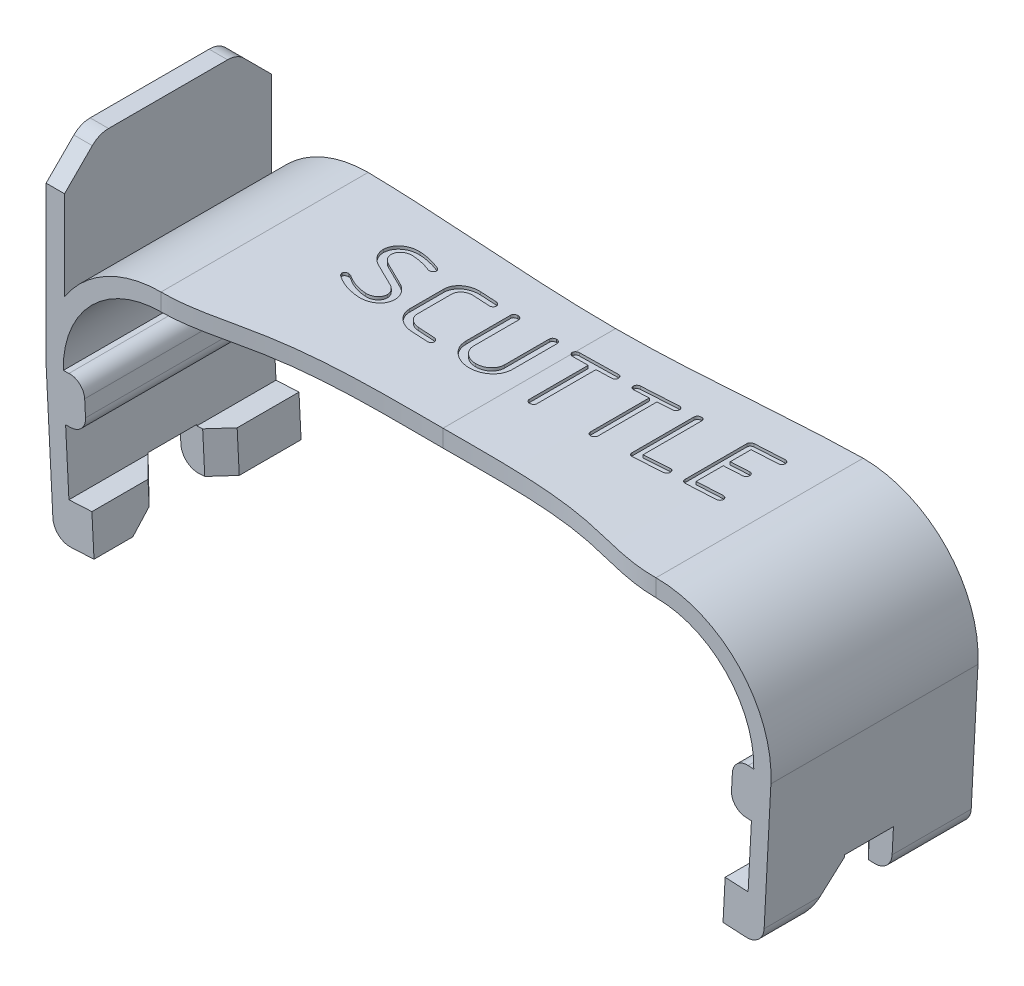
from build123d import *

# Parameters (mm, degrees)
BOSS_MAIN_DEPTH          = 18
FILLET4_R                = 1.5
CUTLEGS_START            = 0.076448
SKETCH2_W                = 70
SKETCH2_H                = 4.25
CUTLEGS_DEPTH            = 3.601931
CHAMFER1_SIZE            = 1.5
CHAMFER2_SIZE            = 3.5
BOSSTAB_DEPTH            = 18
CHAMFER_TAB_SIZE         = 3
FILLET_TAB_R             = 2
CUTVERSIONNO_DEPTH       = 0.25
BOSSSHOULDER_DEPTH       = 18
FILLET3_R                = 1.3
FILLET3_OF_MIRROR1_R     = 1.3
SLIM_THE_BELT_DEPTH      = 44.040636234
CUT_TEXT_THRU_DEPTH      = 44.040636234
RECOVER_START            = 3.361307
RECOVER_TEXT_DEPTH_DEPTH = 6.026829
CUT_EXTRUDE5_DEPTH       = 6.396505431


with BuildPart() as part:
    # Sketch1 → Boss_Main (new body)
    with BuildSketch(Plane.XY):
        with BuildLine():
            Line((-27.520640474, 3.678379218), (-29.517899543, 3.573707306))
            Line((-29.517899543, 3.573707306), (-30, 12.772732016))
            ThreePointArc((-30, 12.772732016), (-27.677331108, 19.068601537), (-21.511648955, 21.717587644))
            add(Edge.make_bspline(
                [(-21.511648955, 21.717587644), (-14.21553167, 21.717587644), (-7.312557904, 20.717587644), (0, 20.717587644)],
                knots=[0, 0, 0, 0, 1, 1, 1, 1], degree=3))
            add(Edge.make_bspline(
                [(21.511648955, 21.717587644), (14.21553167, 21.717587644), (7.312557904, 20.717587644), (0, 20.717587644)],
                knots=[0, 0, 0, 0, 1, 1, 1, 1], degree=3))
            ThreePointArc((21.511648955, 21.717587644), (27.677331108, 19.068601537), (30, 12.772732016))
            Line((30, 12.772732016), (29.517899543, 3.573707306))
            Line((29.517899543, 3.573707306), (27.520640474, 3.678379218))
            Line((27.520640474, 3.678379218), (27.337464627, 0.183175847))
            Line((27.337464627, 0.183175847), (30.832667999, 0))
            Line((30.832667999, 0), (31.497944302, 12.694228081))
            ThreePointArc((31.497944302, 12.694228081), (28.765392665, 20.101133401), (21.511648955, 23.217587644))
            add(Edge.make_bspline(
                [(21.511648955, 23.217587644), (14.216747764, 23.083388778), (7.306450898, 22.217587644), (0, 22.217587644)],
                knots=[0, 0, 0, 0, 1, 1, 1, 1], degree=3))
            add(Edge.make_bspline(
                [(-21.511648955, 23.217587644), (-14.216747764, 23.083388778), (-7.306450898, 22.217587644), (0, 22.217587644)],
                knots=[0, 0, 0, 0, 1, 1, 1, 1], degree=3))
            ThreePointArc((-21.511648955, 23.217587644), (-28.765392665, 20.101133401), (-31.497944302, 12.694228081))
            Line((-31.497944302, 12.694228081), (-30.832667999, 0))
            Line((-30.832667999, 0), (-27.337464627, 0.183175847))
            Line((-27.337464627, 0.183175847), (-27.520640474, 3.678379218))
        make_face()
    extrude(amount=BOSS_MAIN_DEPTH)

    # Fillet4
    fillet4_edges = [part.edges().sort_by_distance(p)[0] for p in [
        (-30.832667999, 0, 9),
        (30.832667999, 0, 9),
    ]]
    fillet(fillet4_edges, radius=FILLET4_R)

    # Sketch2 → cutLegs (cut)
    with BuildSketch(Plane(origin=(0, 0, 0), x_dir=(1, 0, 0), z_dir=(0, 1, 0)).offset(CUTLEGS_START)):
        with Locations((0, -9)):
            Rectangle(SKETCH2_W, SKETCH2_H)
    extrude(amount=CUTLEGS_DEPTH, mode=Mode.SUBTRACT)

    # Chamfer1
    chamfer1_edges = [part.edges().sort_by_distance(p)[0] for p in [
        (27.429052545, 1.930777423, 6.875),
        (-27.429052545, 1.930777423, 6.875),
    ]]
    chamfer(chamfer1_edges, length=CHAMFER1_SIZE)

    # Chamfer2
    # the kernel refuses this chamfer: 3.5 mm, written as the material it takes off along each edge
    with BuildSketch(Plane(origin=(-18.348909577, 0.654246056, 11.125), x_dir=(-0.05231616890295719, 0.9982519698156036, -0.027495876610586615), z_dir=(-0.9986295347545739, -0.05233595624294376, 0))) as chamfer2_piece_1:
        Polygon((CHAMFER2_SIZE * 0.999621916911, -CHAMFER2_SIZE * 0.0274958766106), (-CHAMFER2_SIZE * 0.0274958766106, -CHAMFER2_SIZE * 0.999621916911), (0, 0), align=None)
    extrude(amount=20.001780916, mode=Mode.SUBTRACT)
    with BuildSketch(Plane(origin=(38.323278747, -0.392566275, 11.125), x_dir=(-0.0014390229951530182, -0.02745819446729907, 0.9996219169112968), z_dir=(-0.9986295347545739, 0.05233595624294331, 0))) as chamfer2_piece_2:
        Polygon((CHAMFER2_SIZE * 0.999621916911, CHAMFER2_SIZE * 0.0274958766106), (-CHAMFER2_SIZE * 0.0274958766106, CHAMFER2_SIZE * 0.999621916911), (0, 0), align=None)
    extrude(amount=20.001780916, mode=Mode.SUBTRACT)

    # Sketch3 → BossTab (add)
    with BuildSketch(Plane(origin=(0, 0, 0), x_dir=(-1, 0, 0), z_dir=(0, 0, -1))):
        with BuildLine():
            Line((29.9, 29.417587644), (29.9, 18.64345163))
            ThreePointArc((29.9, 18.64345163), (31.091435371, 16.085439278), (31.5, 13.293303826))
            Line((31.5, 13.293303826), (31.5, 29.417587644))
            Line((31.5, 29.417587644), (29.9, 29.417587644))
        make_face()
    extrude(amount=-BOSSTAB_DEPTH)

    # chamfer tab
    chamfer_tab_edges = [part.edges().sort_by_distance(p)[0] for p in [
        (-30.7, 29.417587644, 18),
        (-30.7, 29.417587644, 0),
    ]]
    chamfer(chamfer_tab_edges, length=CHAMFER_TAB_SIZE)

    # fillet tab
    fillet_tab_edges = [part.edges().sort_by_distance(p)[0] for p in [
        (-30.7, 29.417587644, 3),
        (-30.7, 29.417587644, 15),
    ]]
    fillet(fillet_tab_edges, radius=FILLET_TAB_R)

    # Sketch4 → CutVersionNo (cut)
    with BuildSketch(Plane(origin=(-30.748215708, -1.611445702, 0), x_dir=(0, 0, 1), z_dir=(-0.998629534754574, -0.05233595624294361, 0))):
        with BuildLine():
            add(Edge.make_bspline(
                [(9.725795541, 13.640286776), (9.755847921, 13.619345675), (9.81563083, 13.577687746), (9.911451638, 13.526185365), (10.009422761, 13.47973722), (10.143910335, 13.432980456), (10.312884779, 13.389886967), (10.4501203, 13.383569767), (10.517073171, 13.380487805)],
                knots=[0, 0, 0, 0, 0.778766114, 1.549191915, 2.311612567, 3.0831544, 4.576963279, 6, 6, 6, 6], degree=3))
            add(Edge.make_bspline(
                [(10.517073171, 13.380487805), (10.569223261, 13.383444561), (10.671727173, 13.389256229), (10.82170011, 13.416920873), (10.965212147, 13.458328457), (11.10261435, 13.514762826), (11.233198995, 13.585830847), (11.357867547, 13.670672771), (11.474899596, 13.771161873), (11.583906746, 13.88548874), (11.683386369, 14.010468243), (11.771471454, 14.143943308), (11.84790171, 14.284746751), (11.909741103, 14.433680508), (11.958565023, 14.589703757), (11.995503958, 14.752739831), (12.018522712, 14.92337593), (12.024034797, 15.039771322), (12.026829268, 15.098780488)],
                knots=[0, 0, 0, 0, 0.989081304, 1.944094486, 2.882716619, 3.815471811, 4.753081748, 5.695395469, 6.668019171, 7.670569335, 8.684801918, 9.691163007, 10.697642033, 11.716312014, 12.742065048, 13.792402142, 14.880810423, 16, 16, 16, 16], degree=3))
            add(Edge.make_bspline(
                [(12.026829268, 15.098780488), (12.024980998, 15.146378938), (12.021322557, 15.240594683), (12.005645317, 15.379259176), (11.979848074, 15.513368348), (11.944444354, 15.642510224), (11.900097626, 15.767470366), (11.848481199, 15.888400013), (11.78510899, 16.003481853), (11.691567163, 16.150850972), (11.555508316, 16.320660445), (11.372300874, 16.503779475), (11.166641491, 16.662569617), (11.015408011, 16.746588768), (10.93902439, 16.78902439)],
                knots=[0, 0, 0, 0, 0.810479605, 1.604252648, 2.372191281, 3.132457069, 3.88076241, 4.627467096, 5.367314194, 6.113858626, 7.596218838, 9.058882707, 10.514527429, 12, 12, 12, 12], degree=3))
            add(Edge.make_bspline(
                [(10.93902439, 16.78902439), (10.920629946, 16.797560074), (10.883112907, 16.814969331), (10.841792762, 16.817170657), (10.820731707, 16.818292683)],
                knots=[0, 0, 0, 0, 0.980591471, 2, 2, 2, 2], degree=3))
            add(Edge.make_bspline(
                [(10.820731707, 16.818292683), (10.799826467, 16.81681857), (10.759094206, 16.813946375), (10.70120484, 16.793241354), (10.649430338, 16.76104432), (10.60407822, 16.71770401), (10.566758679, 16.666050897), (10.539247903, 16.606866125), (10.522018616, 16.541581759), (10.518755227, 16.495634119), (10.517073171, 16.47195122)],
                knots=[0, 0, 0, 0, 0.981836816, 1.913033863, 2.857484277, 3.831283074, 4.84481494, 5.837022256, 6.885131342, 8, 8, 8, 8], degree=3))
            add(Edge.make_bspline(
                [(10.517073171, 16.47195122), (10.521416869, 16.432416103), (10.529535535, 16.358522292), (10.574058939, 16.259312048), (10.643717267, 16.181397293), (10.705174771, 16.151742016), (10.736585366, 16.136585366)],
                knots=[0, 0, 0, 0, 1.117423702, 2.088540581, 3.023063541, 4, 4, 4, 4], degree=3))
            add(Edge.make_bspline(
                [(10.736585366, 16.136585366), (10.786685246, 16.115550555), (10.885979207, 16.07386124), (11.018118262, 15.981224693), (11.135399247, 15.870312649), (11.231483752, 15.737699361), (11.31129605, 15.591708953), (11.369093405, 15.432706805), (11.4034177, 15.262822992), (11.409231518, 15.146090136), (11.412195122, 15.086585366)],
                knots=[0, 0, 0, 0, 0.978764494, 1.939833073, 2.895165221, 3.881798891, 4.883635992, 5.891506291, 6.925191793, 8, 8, 8, 8], degree=3))
            add(Edge.make_bspline(
                [(11.412195122, 15.086585366), (11.405998343, 15.016682689), (11.393961733, 14.880903868), (11.337268678, 14.687573194), (11.25315498, 14.511935821), (11.157382148, 14.383120892), (11.069983894, 14.292514605), (11.000615628, 14.23159872), (10.925310384, 14.182542805), (10.848465625, 14.1382559), (10.76605618, 14.105898154), (10.680316265, 14.081361741), (10.590811288, 14.065129069), (10.529740063, 14.061563589), (10.498780488, 14.059756098)],
                knots=[0, 0, 0, 0, 1.66314367, 3.230486954, 4.754542411, 6.266319275, 7.017306668, 7.742923604, 8.452436799, 9.148156273, 9.845481254, 10.548264051, 11.264053932, 12, 12, 12, 12], degree=3))
            add(Edge.make_bspline(
                [(10.498780488, 14.059756098), (10.456720893, 14.0611298), (10.372857015, 14.063868866), (10.250982666, 14.094178451), (10.131990776, 14.13712481), (10.05991773, 14.181191033), (10.023170732, 14.203658537)],
                knots=[0, 0, 0, 0, 0.999590369, 1.993113009, 2.976773197, 4, 4, 4, 4], degree=3))
            Line((10.023170732, 14.203658537), (6.468540396, 16.748638767))
            add(Edge.make_bspline(
                [(6.468540396, 16.748638767), (6.445963359, 16.763467367), (6.399421477, 16.794036081), (6.344257896, 16.801997931), (6.315853659, 16.806097561)],
                knots=[0, 0, 0, 0, 0.970181507, 2, 2, 2, 2], degree=3))
            add(Edge.make_bspline(
                [(6.315853659, 16.806097561), (6.294966239, 16.804568381), (6.253884082, 16.801560732), (6.195400754, 16.78135895), (6.143341228, 16.748819357), (6.097983085, 16.705516901), (6.06064176, 16.653855427), (6.033225013, 16.594664516), (6.015625922, 16.529452817), (6.013361409, 16.483449221), (6.012195122, 16.459756098)],
                knots=[0, 0, 0, 0, 0.97984351, 1.927192764, 2.869725772, 3.841547582, 4.853021796, 5.843214751, 6.889195987, 8, 8, 8, 8], degree=3))
            Line((6.012195122, 16.459756098), (6.012195122, 13.714635337))
            add(Edge.make_bspline(
                [(6.012195122, 13.714635337), (6.013337172, 13.690929128), (6.015554608, 13.644900496), (6.033583336, 13.579503986), (6.059906166, 13.519681446), (6.098451284, 13.468800664), (6.143282524, 13.425531069), (6.195416277, 13.393041823), (6.253880037, 13.372826768), (6.294964875, 13.369820938), (6.315853659, 13.368292683)],
                knots=[0, 0, 0, 0, 1.110556465, 2.156287122, 3.163552687, 4.159372712, 5.130961709, 6.073268921, 7.020391225, 8, 8, 8, 8], degree=3))
            add(Edge.make_bspline(
                [(6.315853659, 13.368292683), (6.336771121, 13.369723513), (6.377142926, 13.37248509), (6.434197802, 13.393385276), (6.484834998, 13.425558408), (6.528397566, 13.468882546), (6.565839227, 13.519756414), (6.59053786, 13.579791126), (6.608921159, 13.644865709), (6.611082151, 13.690916643), (6.612195122, 13.714634146)],
                knots=[0, 0, 0, 0, 0.990128165, 1.91099958, 2.847086422, 3.815192112, 4.810376283, 5.820576655, 6.877536742, 8, 8, 8, 8], degree=3))
            Line((6.612195122, 13.714634146), (6.612195122, 15.84611876))
            Line((6.612195122, 15.84611876), (9.725795541, 13.640286776))
        make_face()
        with BuildLine():
            add(Edge.make_bspline(
                [(6.31908346, 12.038816692), (6.29793846, 12.037087235), (6.256622826, 12.033708015), (6.197786511, 12.013640685), (6.145714256, 11.980642967), (6.099512427, 11.938307395), (6.061815391, 11.886755582), (6.032948303, 11.828398554), (6.015714139, 11.762826817), (6.013391398, 11.716850042), (6.012195122, 11.693170732)],
                knots=[0, 0, 0, 0, 0.990630529, 1.935612504, 2.875790269, 3.859097764, 4.852667412, 5.848604223, 6.891971714, 8, 8, 8, 8], degree=3))
            add(Edge.make_bspline(
                [(6.012195122, 11.693170732), (6.01337268, 11.669482447), (6.015659079, 11.623488247), (6.033244969, 11.557683277), (6.061444233, 11.498589392), (6.099553227, 11.446836416), (6.145702801, 11.404464789), (6.197793445, 11.371515659), (6.25633518, 11.351379704), (6.297409333, 11.348363035), (6.318292683, 11.346829268)],
                knots=[0, 0, 0, 0, 1.107489061, 2.150348794, 3.162923206, 4.156009331, 5.138838297, 6.078558522, 7.023080619, 8, 8, 8, 8], degree=3))
            Line((6.318292683, 11.346829268), (6.617447123, 11.347524771))
            add(Edge.make_bspline(
                [(6.617447123, 11.347524771), (6.639033544, 11.34873111), (6.681238191, 11.351089681), (6.741086282, 11.371638824), (6.794296321, 11.403713823), (6.839448519, 11.447001155), (6.876499888, 11.498632753), (6.903079382, 11.557985999), (6.921009586, 11.623451557), (6.923241003, 11.669469975), (6.924390244, 11.693170732)],
                knots=[0, 0, 0, 0, 1.00374458, 1.962469067, 2.914617217, 3.879687234, 4.857691946, 5.858199153, 6.896913368, 8, 8, 8, 8], degree=3))
            add(Edge.make_bspline(
                [(6.924390244, 11.693170732), (6.923222729, 11.716863071), (6.920955832, 11.762865144), (6.903373522, 11.828087562), (6.876136708, 11.886723249), (6.839487541, 11.938141717), (6.794284811, 11.981391215), (6.741094055, 12.01352976), (6.681075489, 12.033906106), (6.638779242, 12.036804997), (6.617073171, 12.038292683)],
                knots=[0, 0, 0, 0, 1.104502498, 2.144549954, 3.129125613, 4.108385643, 5.074694375, 6.028064655, 6.988019711, 8, 8, 8, 8], degree=3))
            Line((6.617073171, 12.038292683), (6.31908346, 12.038816692))
        make_face()
        with BuildLine():
            add(Edge.make_bspline(
                [(9.725795541, 6.86565263), (9.755847921, 6.844711529), (9.81563083, 6.803053599), (9.911451638, 6.751551219), (10.009422761, 6.705103073), (10.143910335, 6.65834631), (10.312884779, 6.615252821), (10.4501203, 6.608935621), (10.517073171, 6.605853659)],
                knots=[0, 0, 0, 0, 0.778766114, 1.549191915, 2.311612567, 3.0831544, 4.576963279, 6, 6, 6, 6], degree=3))
            add(Edge.make_bspline(
                [(10.517073171, 6.605853659), (10.569223261, 6.608810414), (10.671727173, 6.614622083), (10.82170011, 6.642286727), (10.965212147, 6.683694311), (11.10261435, 6.740128679), (11.233198995, 6.811196701), (11.357867547, 6.896038625), (11.474899596, 6.996527727), (11.583906746, 7.110854594), (11.683386369, 7.235834097), (11.771471454, 7.369309161), (11.84790171, 7.510112604), (11.909741103, 7.659046361), (11.958565023, 7.815069611), (11.995503958, 7.978105684), (12.018522712, 8.148741784), (12.024034797, 8.265137175), (12.026829268, 8.324146341)],
                knots=[0, 0, 0, 0, 0.989081304, 1.944094486, 2.882716619, 3.815471811, 4.753081748, 5.695395469, 6.668019171, 7.670569335, 8.684801918, 9.691163007, 10.697642033, 11.716312014, 12.742065048, 13.792402142, 14.880810423, 16, 16, 16, 16], degree=3))
            add(Edge.make_bspline(
                [(12.026829268, 8.324146341), (12.024980998, 8.371744792), (12.021322557, 8.465960537), (12.005645317, 8.60462503), (11.979848074, 8.738734202), (11.944444354, 8.867876077), (11.900097626, 8.99283622), (11.848481199, 9.113765866), (11.78510899, 9.228847707), (11.691567163, 9.376216826), (11.555508316, 9.546026299), (11.372300874, 9.729145329), (11.166641491, 9.887935471), (11.015408011, 9.971954621), (10.93902439, 10.014390244)],
                knots=[0, 0, 0, 0, 0.810479605, 1.604252648, 2.372191281, 3.132457069, 3.88076241, 4.627467096, 5.367314194, 6.113858626, 7.596218838, 9.058882707, 10.514527429, 12, 12, 12, 12], degree=3))
            add(Edge.make_bspline(
                [(10.93902439, 10.014390244), (10.920629946, 10.022925928), (10.883112907, 10.040335184), (10.841792762, 10.042536511), (10.820731707, 10.043658537)],
                knots=[0, 0, 0, 0, 0.980591471, 2, 2, 2, 2], degree=3))
            add(Edge.make_bspline(
                [(10.820731707, 10.043658537), (10.799826467, 10.042184424), (10.759094206, 10.039312228), (10.70120484, 10.018607208), (10.649430338, 9.986410174), (10.60407822, 9.943069864), (10.566758679, 9.891416751), (10.539247903, 9.832231978), (10.522018616, 9.766947613), (10.518755227, 9.720999972), (10.517073171, 9.697317073)],
                knots=[0, 0, 0, 0, 0.981836816, 1.913033863, 2.857484277, 3.831283074, 4.84481494, 5.837022256, 6.885131342, 8, 8, 8, 8], degree=3))
            add(Edge.make_bspline(
                [(10.517073171, 9.697317073), (10.521416869, 9.657781956), (10.529535535, 9.583888145), (10.574058939, 9.484677901), (10.643717267, 9.406763147), (10.705174771, 9.37710787), (10.736585366, 9.36195122)],
                knots=[0, 0, 0, 0, 1.117423702, 2.088540581, 3.023063541, 4, 4, 4, 4], degree=3))
            add(Edge.make_bspline(
                [(10.736585366, 9.36195122), (10.786685246, 9.340916409), (10.885979207, 9.299227093), (11.018118262, 9.206590546), (11.135399247, 9.095678502), (11.231483752, 8.963065215), (11.31129605, 8.817074807), (11.369093405, 8.658072659), (11.4034177, 8.488188846), (11.409231518, 8.371455989), (11.412195122, 8.31195122)],
                knots=[0, 0, 0, 0, 0.978764494, 1.939833073, 2.895165221, 3.881798891, 4.883635992, 5.891506291, 6.925191793, 8, 8, 8, 8], degree=3))
            add(Edge.make_bspline(
                [(11.412195122, 8.31195122), (11.405998343, 8.242048542), (11.393961733, 8.106269721), (11.337268678, 7.912939047), (11.25315498, 7.737301675), (11.157382148, 7.608486745), (11.069983894, 7.517880459), (11.000615628, 7.456964574), (10.925310384, 7.407908658), (10.848465625, 7.363621754), (10.76605618, 7.331264008), (10.680316265, 7.306727595), (10.590811288, 7.290494923), (10.529740063, 7.286929443), (10.498780488, 7.285121951)],
                knots=[0, 0, 0, 0, 1.66314367, 3.230486954, 4.754542411, 6.266319275, 7.017306668, 7.742923604, 8.452436799, 9.148156273, 9.845481254, 10.548264051, 11.264053932, 12, 12, 12, 12], degree=3))
            add(Edge.make_bspline(
                [(10.498780488, 7.285121951), (10.456720893, 7.286495654), (10.372857015, 7.28923472), (10.250982666, 7.319544305), (10.131990776, 7.362490663), (10.05991773, 7.406556887), (10.023170732, 7.42902439)],
                knots=[0, 0, 0, 0, 0.999590369, 1.993113009, 2.976773197, 4, 4, 4, 4], degree=3))
            Line((10.023170732, 7.42902439), (6.468540396, 9.974004621))
            add(Edge.make_bspline(
                [(6.468540396, 9.974004621), (6.445963359, 9.988833221), (6.399421477, 10.019401934), (6.344257896, 10.027363784), (6.315853659, 10.031463415)],
                knots=[0, 0, 0, 0, 0.970181507, 2, 2, 2, 2], degree=3))
            add(Edge.make_bspline(
                [(6.315853659, 10.031463415), (6.294966239, 10.029934235), (6.253884082, 10.026926586), (6.195400754, 10.006724804), (6.143341228, 9.97418521), (6.097983085, 9.930882755), (6.06064176, 9.879221281), (6.033225013, 9.820030369), (6.015625922, 9.75481867), (6.013361409, 9.708815074), (6.012195122, 9.685121951)],
                knots=[0, 0, 0, 0, 0.97984351, 1.927192764, 2.869725772, 3.841547582, 4.853021796, 5.843214751, 6.889195987, 8, 8, 8, 8], degree=3))
            Line((6.012195122, 9.685121951), (6.012195122, 6.940001191))
            add(Edge.make_bspline(
                [(6.012195122, 6.940001191), (6.013337172, 6.916294981), (6.015554608, 6.87026635), (6.033583336, 6.804869839), (6.059906166, 6.7450473), (6.098451284, 6.694166518), (6.143282524, 6.650896923), (6.195416277, 6.618407676), (6.253880037, 6.598192622), (6.294964875, 6.595186792), (6.315853659, 6.593658537)],
                knots=[0, 0, 0, 0, 1.110556465, 2.156287122, 3.163552687, 4.159372712, 5.130961709, 6.073268921, 7.020391225, 8, 8, 8, 8], degree=3))
            add(Edge.make_bspline(
                [(6.315853659, 6.593658537), (6.336771121, 6.595089367), (6.377142926, 6.597850944), (6.434197802, 6.61875113), (6.484834998, 6.650924262), (6.528397566, 6.6942484), (6.565839227, 6.745122268), (6.59053786, 6.80515698), (6.608921159, 6.870231563), (6.611082151, 6.916282496), (6.612195122, 6.94)],
                knots=[0, 0, 0, 0, 0.990128165, 1.91099958, 2.847086422, 3.815192112, 4.810376283, 5.820576655, 6.877536742, 8, 8, 8, 8], degree=3))
            Line((6.612195122, 6.94), (6.612195122, 9.071484613))
            Line((6.612195122, 9.071484613), (9.725795541, 6.86565263))
        make_face()
    extrude(amount=-CUTVERSIONNO_DEPTH, mode=Mode.SUBTRACT)

    # Sketch5 → BossShoulder (add, through all)
    with BuildSketch(Plane.XY):
        Polygon((29.805747303, 9.066169747), (28.00821414, 9.160374468), (28.217557965, 13.154892607), (30.015091128, 13.060687886), align=None)
    bossshoulder = extrude(amount=BOSSSHOULDER_DEPTH)

    # Fillet3
    fillet3_edges = [part.edges().sort_by_distance(p)[0] for p in [
        (28.217557965, 13.154892607, 9),
        (28.00821414, 9.160374468, 9),
    ]]
    fillet(fillet3_edges, radius=FILLET3_R)

    # Mirror1: BossShoulder across plane
    add(bossshoulder.mirror(Plane(origin=(0, 0, 0), x_dir=(0, 0, 1), z_dir=(1, 0, 0))))

    # Fillet3 of Mirror1
    fillet3_of_mirror1_edges = [part.edges().sort_by_distance(p)[0] for p in [
        (-28.217557965, 13.154892607, 9),
        (-28.00821414, 9.160374468, 9),
    ]]
    fillet(fillet3_of_mirror1_edges, radius=FILLET3_OF_MIRROR1_R)

    # Sketch7 → slim the belt (cut, through all)
    with BuildSketch(Plane(origin=(0, 23.217587644, 0), x_dir=(1, 0, 0), z_dir=(0, 1, 0))):
        with BuildLine():
            Line((-21.511648955, -18), (21.511648955, -18))
            add(Edge.make_bspline(
                [(21.511648955, -18), (19.072372733, -18), (12.085597571, -15.421889127), (4.791106984, -15), (0, -15)],
                knots=[0, 0, 0, 0, 0.338256278, 1, 1, 1, 1], degree=3))
            add(Edge.make_bspline(
                [(-21.511648955, -18), (-19.072372733, -18), (-12.085597571, -15.421889127), (-4.791106984, -15), (0, -15)],
                knots=[0, 0, 0, 0, 0.338256278, 1, 1, 1, 1], degree=3))
        make_face()
    extrude(amount=-SLIM_THE_BELT_DEPTH, mode=Mode.SUBTRACT)

    # Sketch6<3> → cut text THRU (cut, through all)
    with BuildSketch(Plane(origin=(0, 23.217587644, 0), x_dir=(1, 0, 0), z_dir=(0, 1, 0))):
        with BuildLine():
            Line((-15.346122406, -8.47594115), (-15.315645319, -8.486190292))
            add(Edge.make_bspline(
                [(-15.315645319, -8.486190292), (-15.313310699, -8.511119398), (-15.308824357, -8.559024626), (-15.280236496, -8.625484291), (-15.235675434, -8.681869027), (-15.195753939, -8.708631536), (-15.175390698, -8.722282613)],
                knots=[0, 0, 0, 0, 1.041192071, 2.000815561, 2.980251761, 4, 4, 4, 4], degree=3))
            add(Edge.make_bspline(
                [(-15.175390698, -8.722282613), (-15.094141569, -8.775367195), (-14.931866245, -8.881390704), (-14.672916192, -9.014251614), (-14.405277956, -9.130149322), (-14.127242588, -9.223350272), (-13.841894405, -9.296582332), (-13.551277581, -9.348709951), (-13.256229538, -9.38166657), (-13.057996507, -9.385971561), (-12.958317528, -9.388136272)],
                knots=[0, 0, 0, 0, 0.990829927, 1.978941188, 2.968586973, 3.9679082, 4.971044251, 5.975357124, 6.981933857, 8, 8, 8, 8], degree=3))
            add(Edge.make_bspline(
                [(-12.958317528, -9.388136272), (-12.900513202, -9.385412368), (-12.786921268, -9.380059593), (-12.620205493, -9.356114748), (-12.460384157, -9.321626792), (-12.308070794, -9.272477722), (-12.163761438, -9.20992399), (-12.026605408, -9.135257126), (-11.896454571, -9.048331743), (-11.775370354, -8.948836343), (-11.665089859, -8.839539268), (-11.566440082, -8.72356372), (-11.483010305, -8.599629103), (-11.414478573, -8.46867628), (-11.360575431, -8.330746105), (-11.320227717, -8.186611896), (-11.294255325, -8.035340494), (-11.288219442, -7.93213687), (-11.285146796, -7.879599686)],
                knots=[0, 0, 0, 0, 1.111169605, 2.18357197, 3.231380287, 4.248891365, 5.252795393, 6.248770528, 7.245113002, 8.255043627, 9.25456404, 10.224479873, 11.175344767, 12.118481543, 13.058217281, 14.015092274, 14.989556206, 16, 16, 16, 16], degree=3))
            add(Edge.make_bspline(
                [(-11.285146796, -7.879599686), (-11.289270788, -7.809857601), (-11.297439208, -7.671718956), (-11.344491799, -7.468751699), (-11.424758628, -7.275942162), (-11.530054468, -7.091701378), (-11.66300017, -6.923104667), (-11.818745845, -6.771992682), (-11.997440781, -6.641723681), (-12.130069085, -6.573805705), (-12.197341918, -6.539355784)],
                knots=[0, 0, 0, 0, 0.979511379, 1.940125168, 2.907578557, 3.902001852, 4.909954452, 5.910742383, 6.940269362, 8, 8, 8, 8], degree=3))
            Line((-12.197341918, -6.539355784), (-14.084868118, -5.670770132))
            add(Edge.make_bspline(
                [(-14.084868118, -5.670770132), (-14.125471757, -5.650040544), (-14.20523846, -5.609316833), (-14.312148559, -5.529492057), (-14.406966845, -5.438694252), (-14.488421721, -5.336719422), (-14.55421975, -5.226325856), (-14.602075927, -5.110919502), (-14.633026393, -4.992156483), (-14.637688473, -4.911489065), (-14.640024845, -4.871063101)],
                knots=[0, 0, 0, 0, 1.066233812, 2.094638797, 3.111518189, 4.134619804, 5.142183801, 6.111217298, 7.053448548, 8, 8, 8, 8], degree=3))
            add(Edge.make_bspline(
                [(-14.640024845, -4.871063101), (-14.638288841, -4.839680354), (-14.634886175, -4.778168374), (-14.617794849, -4.688194165), (-14.595820235, -4.601413786), (-14.562313022, -4.519368895), (-14.520079557, -4.441629758), (-14.470352062, -4.367652306), (-14.412365273, -4.296985031), (-14.345672335, -4.232141054), (-14.272717996, -4.172449219), (-14.194906034, -4.119829148), (-14.111921205, -4.075955904), (-14.025548537, -4.037539573), (-13.933893312, -4.008363575), (-13.837750328, -3.988336734), (-13.737667492, -3.972567259), (-13.668950755, -3.969955324), (-13.633927284, -3.968624076)],
                knots=[0, 0, 0, 0, 1.005596469, 1.971026677, 2.92799113, 3.868516583, 4.800622899, 5.757587351, 6.719499216, 7.723070653, 8.731697048, 9.735606273, 10.725914068, 11.734624498, 12.759920778, 13.799339356, 14.878369703, 16, 16, 16, 16], degree=3))
            add(Edge.make_bspline(
                [(-13.633927284, -3.968624076), (-13.499215364, -3.972430608), (-13.232531769, -3.979966241), (-12.838321273, -4.03128187), (-12.454185945, -4.114008846), (-12.207248651, -4.19679338), (-12.083927284, -4.238136272)],
                knots=[0, 0, 0, 0, 1.022490778, 2.024182546, 3.013269703, 4, 4, 4, 4], degree=3))
            add(Edge.make_bspline(
                [(-12.083927284, -4.238136272), (-12.061361976, -4.245444975), (-12.017745727, -4.259571893), (-11.950660225, -4.26704691), (-11.885905345, -4.261753383), (-11.824111486, -4.246478742), (-11.766736696, -4.219192439), (-11.717367133, -4.18114418), (-11.673526201, -4.134858723), (-11.653054116, -4.097635707), (-11.642463869, -4.078380174)],
                knots=[0, 0, 0, 0, 1.099275457, 2.124778106, 3.109158742, 4.102545792, 5.06496722, 6.035130911, 6.983569686, 8, 8, 8, 8], degree=3))
            add(Edge.make_bspline(
                [(-11.642463869, -4.078380174), (-11.63465782, -4.05830966), (-11.619554931, -4.019477886), (-11.61222287, -3.958905728), (-11.618337082, -3.9004263), (-11.638362872, -3.845723509), (-11.669210847, -3.794949311), (-11.710542942, -3.750988812), (-11.762703666, -3.716006628), (-11.801497676, -3.699292949), (-11.821732162, -3.690575296)],
                knots=[0, 0, 0, 0, 1.062797156, 2.056265174, 2.987446933, 3.948591618, 4.914989074, 5.911509854, 6.910668815, 8, 8, 8, 8], degree=3))
            add(Edge.make_bspline(
                [(-11.821732162, -3.690575296), (-11.893863014, -3.66429859), (-12.037893712, -3.611829332), (-12.258174413, -3.545042392), (-12.480646098, -3.487660593), (-12.706066641, -3.440945234), (-12.934098227, -3.405991973), (-13.165185282, -3.38044746), (-13.398722644, -3.363805001), (-13.555444175, -3.362140535), (-13.633927284, -3.361307003)],
                knots=[0, 0, 0, 0, 0.994616127, 1.986046882, 2.981290497, 3.970970533, 4.967774179, 5.969464964, 6.983147361, 8, 8, 8, 8], degree=3))
            add(Edge.make_bspline(
                [(-13.633927284, -3.361307003), (-13.692131206, -3.364051753), (-13.806117128, -3.36942704), (-13.973438498, -3.392926142), (-14.132924218, -3.429367568), (-14.285694737, -3.478379974), (-14.431176009, -3.540605307), (-14.569161084, -3.616287293), (-14.699251336, -3.705207854), (-14.821657159, -3.804248975), (-14.933752673, -3.913174059), (-15.031274626, -4.03112112), (-15.116878466, -4.15419966), (-15.184799277, -4.28596391), (-15.239975803, -4.423141626), (-15.282090056, -4.566280782), (-15.307659298, -4.716556802), (-15.313752162, -4.818939058), (-15.316854113, -4.871063101)],
                knots=[0, 0, 0, 0, 1.116474624, 2.186491636, 3.233681135, 4.248928954, 5.257757355, 6.262091931, 7.260575583, 8.27429723, 9.277149572, 10.250881212, 11.204004777, 12.145043726, 13.085566364, 14.034955993, 14.999572353, 16, 16, 16, 16], degree=3))
            add(Edge.make_bspline(
                [(-15.316854113, -4.871063101), (-15.313066624, -4.940893454), (-15.30557594, -5.079000009), (-15.253605177, -5.280846119), (-15.176151822, -5.475018887), (-15.066192772, -5.657507998), (-14.932750081, -5.827018207), (-14.775271764, -5.977478734), (-14.596943458, -6.109697142), (-14.463907947, -6.177009406), (-14.396122406, -6.211307003)],
                knots=[0, 0, 0, 0, 0.977150961, 1.93255437, 2.902950099, 3.895809642, 4.904855892, 5.915378295, 6.937823362, 8, 8, 8, 8], degree=3))
            Line((-14.396122406, -6.211307003), (-12.506466822, -7.078480212))
            add(Edge.make_bspline(
                [(-12.506466822, -7.078480212), (-12.466751885, -7.099965104), (-12.38811101, -7.142508057), (-12.280145517, -7.220219093), (-12.186520874, -7.312468125), (-12.10541344, -7.41371059), (-12.038805928, -7.523310719), (-11.991825779, -7.638751297), (-11.958713848, -7.757474774), (-11.954393269, -7.838728233), (-11.952219967, -7.879599686)],
                knots=[0, 0, 0, 0, 1.057704704, 2.094396411, 3.105018147, 4.128713523, 5.12868068, 6.09827656, 7.043410564, 8, 8, 8, 8], degree=3))
            add(Edge.make_bspline(
                [(-11.952219967, -7.879599686), (-11.954033325, -7.911370274), (-11.957611084, -7.974053692), (-11.97369715, -8.065601465), (-11.998239164, -8.153029534), (-12.031123751, -8.236101777), (-12.072899476, -8.315299283), (-12.124820212, -8.389196481), (-12.183104736, -8.460608886), (-12.272656461, -8.547664208), (-12.398758552, -8.641904049), (-12.570114036, -8.724440652), (-12.758558224, -8.77724237), (-12.890488296, -8.786048037), (-12.958317528, -8.790575296)],
                knots=[0, 0, 0, 0, 0.761649341, 1.502735335, 2.220891218, 2.933215881, 3.638788499, 4.359842309, 5.092825947, 5.84325413, 7.346508535, 8.840052486, 10.375375603, 12, 12, 12, 12], degree=3))
            add(Edge.make_bspline(
                [(-12.958317528, -8.790575296), (-13.040104672, -8.788107983), (-13.201661006, -8.783234235), (-13.440759482, -8.75522227), (-13.67384543, -8.713787644), (-13.900014245, -8.652121276), (-14.121526592, -8.580663738), (-14.335561622, -8.488658798), (-14.544721855, -8.383886317), (-14.677239068, -8.300618551), (-14.743683381, -8.258867979)],
                knots=[0, 0, 0, 0, 1.039475872, 2.053304507, 3.056507143, 4.045238205, 5.030385893, 6.012005103, 7.003216625, 8, 8, 8, 8], degree=3))
            add(Edge.make_bspline(
                [(-14.743683381, -8.258867979), (-14.766168907, -8.246465176), (-14.809645742, -8.222483765), (-14.877199251, -8.197706664), (-14.942250333, -8.178551265), (-14.98583195, -8.17597752), (-15.007098015, -8.174721637)],
                knots=[0, 0, 0, 0, 1.101574421, 2.129946617, 3.087489616, 4, 4, 4, 4], degree=3))
            add(Edge.make_bspline(
                [(-15.007098015, -8.174721637), (-15.030388034, -8.175885851), (-15.075597496, -8.178145767), (-15.139594197, -8.195764787), (-15.197639194, -8.223151423), (-15.248065328, -8.260925986), (-15.291004074, -8.305347965), (-15.322707815, -8.356770238), (-15.341424805, -8.414546856), (-15.34452578, -8.45507439), (-15.346122406, -8.47594115)],
                knots=[0, 0, 0, 0, 1.10849014, 2.151747592, 3.139570676, 4.150860763, 5.137543393, 6.067841523, 7.005173005, 8, 8, 8, 8], degree=3))
        make_face()
        with BuildLine():
            Line((-7.011976064, -3.388136272), (-8.35546406, -3.387119217))
            add(Edge.make_bspline(
                [(-8.35546406, -3.387119217), (-8.413808537, -3.389770536), (-8.527941673, -3.394957031), (-8.695379209, -3.418573632), (-8.854910567, -3.454888152), (-9.007368977, -3.504249716), (-9.153121463, -3.564871381), (-9.291004689, -3.639526882), (-9.421593956, -3.72700642), (-9.543190111, -3.826259749), (-9.65563994, -3.933865158), (-9.75369296, -4.050696806), (-9.838223573, -4.173864722), (-9.908154557, -4.303875067), (-9.963622964, -4.440370774), (-10.003806264, -4.58395709), (-10.029612281, -4.734432874), (-10.035711988, -4.8372262), (-10.038805332, -4.889355784)],
                knots=[0, 0, 0, 0, 1.12078087, 2.192465184, 3.241286415, 4.258116194, 5.265467853, 6.267636707, 7.263312057, 8.278613287, 9.277586393, 10.246852797, 11.201461521, 12.140730162, 13.075481267, 14.024202028, 14.998013485, 16, 16, 16, 16], degree=3))
            Line((-10.038805332, -4.889355784), (-10.038805332, -7.873025753))
            add(Edge.make_bspline(
                [(-10.038805332, -7.873025753), (-10.035719612, -7.925314791), (-10.029644007, -8.028268861), (-10.003805281, -8.17890105), (-9.963622217, -8.322486046), (-9.908158448, -8.458986922), (-9.838208552, -8.588977748), (-9.753750491, -8.712220152), (-9.655235748, -8.828982814), (-9.543632293, -8.937866468), (-9.421535413, -9.037010978), (-9.291020339, -9.124566313), (-9.1531173, -9.199202872), (-9.007369862, -9.259824449), (-8.854911249, -9.30920588), (-8.695375394, -9.345437861), (-8.52811333, -9.369354986), (-8.414089818, -9.373715181), (-8.355878503, -9.37594115)],
                knots=[0, 0, 0, 0, 1.004683494, 1.978163265, 2.926560887, 3.860993609, 4.79994233, 5.754225907, 6.723162173, 7.727235051, 8.742190463, 9.737526679, 10.739354188, 11.746362737, 12.762846178, 13.811310173, 14.882629465, 16, 16, 16, 16], degree=3))
            Line((-8.355878503, -9.37594115), (-7.011943909, -9.37594115))
            add(Edge.make_bspline(
                [(-7.011943909, -9.37594115), (-6.988640782, -9.374846563), (-6.943788984, -9.372739799), (-6.880133226, -9.354302064), (-6.821828981, -9.328223308), (-6.772206812, -9.289629843), (-6.730027752, -9.244820186), (-6.69911521, -9.192369958), (-6.678636011, -9.134295047), (-6.675676097, -9.093184479), (-6.674171186, -9.072282613)],
                knots=[0, 0, 0, 0, 1.106504752, 2.129702527, 3.133697482, 4.128140175, 5.100314271, 6.045944679, 7.006498748, 8, 8, 8, 8], degree=3))
            add(Edge.make_bspline(
                [(-6.674171186, -9.072282613), (-6.675578338, -9.051351559), (-6.678294214, -9.010953522), (-6.699444629, -8.954289244), (-6.730052671, -8.903332284), (-6.772288017, -8.859792325), (-6.821903302, -8.822300828), (-6.880422147, -8.797838572), (-6.943764583, -8.779054762), (-6.988650215, -8.777005892), (-7.011976064, -8.77594115)],
                knots=[0, 0, 0, 0, 1.004343215, 1.938435376, 2.877632462, 3.846105017, 4.839726762, 5.846542561, 6.880906373, 8, 8, 8, 8], degree=3))
            Line((-7.011976064, -8.77594115), (-8.35546406, -8.77594115))
            add(Edge.make_bspline(
                [(-8.35546406, -8.77594115), (-8.390595378, -8.774425281), (-8.459334714, -8.771459273), (-8.560019372, -8.758349195), (-8.655466121, -8.735455655), (-8.74738301, -8.708286982), (-8.83455447, -8.671552861), (-8.916072913, -8.625455493), (-8.995115853, -8.574843038), (-9.067549832, -8.514746878), (-9.134337732, -8.450052005), (-9.192289116, -8.379332348), (-9.242266587, -8.305122606), (-9.284394906, -8.226966038), (-9.315763042, -8.143867513), (-9.340801383, -8.057605159), (-9.354963455, -7.966605276), (-9.358806441, -7.904843122), (-9.360756552, -7.873502125)],
                knots=[0, 0, 0, 0, 1.124905651, 2.201035181, 3.242246965, 4.262614352, 5.265167948, 6.260693718, 7.256389417, 8.263992845, 9.266546441, 10.227482717, 11.183476599, 12.126104264, 13.060891957, 14.020330555, 14.995423425, 16, 16, 16, 16], degree=3))
            Line((-9.360756552, -7.873502125), (-9.360755361, -4.888388749))
            add(Edge.make_bspline(
                [(-9.360755361, -4.888388749), (-9.358780371, -4.857374286), (-9.354868529, -4.795944258), (-9.34099533, -4.705604604), (-9.31553195, -4.619865172), (-9.284379464, -4.537131281), (-9.242583427, -4.459149109), (-9.192239626, -4.385947523), (-9.134269232, -4.316475515), (-9.04515916, -4.231345174), (-8.918623247, -4.139349056), (-8.747347711, -4.057591032), (-8.557521955, -4.006318614), (-8.424497398, -3.998346261), (-8.355878503, -3.994233833)],
                knots=[0, 0, 0, 0, 0.749403844, 1.484336514, 2.198039199, 2.902593644, 3.613057117, 4.325479375, 5.042205526, 5.790999962, 7.293074368, 8.792715434, 10.345566222, 12, 12, 12, 12], degree=3))
            Line((-8.355878503, -3.994233833), (-7.011943909, -3.994036138))
            add(Edge.make_bspline(
                [(-7.011943909, -3.994036138), (-6.988639205, -3.993025307), (-6.943779116, -3.991079522), (-6.880134919, -3.972582216), (-6.821826416, -3.946519993), (-6.772215247, -3.907918904), (-6.729997643, -3.863123082), (-6.699420497, -3.8109598), (-6.678445834, -3.753475022), (-6.675620994, -3.712714535), (-6.674171186, -3.691794808)],
                knots=[0, 0, 0, 0, 1.108807959, 2.134385584, 3.140715725, 4.137471386, 5.111906656, 6.0597365, 7.004187969, 8, 8, 8, 8], degree=3))
            add(Edge.make_bspline(
                [(-6.674171186, -3.691794808), (-6.675676097, -3.670892943), (-6.678636011, -3.629782374), (-6.699115209, -3.571707463), (-6.730027752, -3.519257235), (-6.772206811, -3.474447579), (-6.821828983, -3.43585411), (-6.880133217, -3.409775371), (-6.943799343, -3.391334579), (-6.988662101, -3.389229977), (-7.011976064, -3.388136272)],
                knots=[0, 0, 0, 0, 0.993438148, 1.953931204, 2.899501547, 3.871613894, 4.865993421, 5.869924606, 6.89305739, 8, 8, 8, 8], degree=3))
        make_face()
        with BuildLine():
            Line((-1.399780942, -7.579599686), (-1.39977856, -3.684896942))
            add(Edge.make_bspline(
                [(-1.39977856, -3.684896942), (-1.401409543, -3.664308784), (-1.404596994, -3.624073093), (-1.423088407, -3.566433398), (-1.455005158, -3.515926923), (-1.495236211, -3.470297256), (-1.544873257, -3.432669282), (-1.602658641, -3.405548662), (-1.666645113, -3.387894243), (-1.711856028, -3.385639358), (-1.735146796, -3.384477735)],
                knots=[0, 0, 0, 0, 0.988925349, 1.932668926, 2.869331039, 3.836370601, 4.838952153, 5.833532736, 6.883926902, 8, 8, 8, 8], degree=3))
            add(Edge.make_bspline(
                [(-1.735146796, -3.384477735), (-1.758434288, -3.385668935), (-1.80403209, -3.388001351), (-1.868785284, -3.405572873), (-1.927905202, -3.43255114), (-1.978504388, -3.470727333), (-2.021608113, -3.515057593), (-2.052869138, -3.566773399), (-2.073510114, -3.624040966), (-2.076364666, -3.664785637), (-2.077829723, -3.685697247)],
                knots=[0, 0, 0, 0, 1.102643921, 2.1590191, 3.159051629, 4.165008134, 5.146486963, 6.071878666, 7.010419759, 8, 8, 8, 8], degree=3))
            Line((-2.077829723, -3.685697247), (-2.077828532, -7.578540949))
            add(Edge.make_bspline(
                [(-2.077828532, -7.578540949), (-2.080259158, -7.620034307), (-2.085032316, -7.701517142), (-2.106116831, -7.820395111), (-2.138308621, -7.933830163), (-2.180456567, -8.042663267), (-2.236056217, -8.146059158), (-2.303812144, -8.243263987), (-2.380859128, -8.337162896), (-2.469787216, -8.423801787), (-2.566244214, -8.504300307), (-2.670669504, -8.573433934), (-2.779719973, -8.634541453), (-2.895952761, -8.682470494), (-3.017758593, -8.722133971), (-3.145484547, -8.751162467), (-3.279359837, -8.769636463), (-3.370455654, -8.773813586), (-3.416854113, -8.77594115)],
                knots=[0, 0, 0, 0, 1.001631907, 1.966960816, 2.904106956, 3.841560642, 4.775677179, 5.72732203, 6.694987277, 7.700060158, 8.716682429, 9.719889322, 10.715790279, 11.726202737, 12.746080623, 13.8018813, 14.88041708, 16, 16, 16, 16], degree=3))
            add(Edge.make_bspline(
                [(-3.416854113, -8.77594115), (-3.463245439, -8.77377538), (-3.554729669, -8.769504458), (-3.688709073, -8.75152117), (-3.816609688, -8.721622817), (-3.938406422, -8.683105014), (-4.054463233, -8.633837124), (-4.164080222, -8.573862084), (-4.268645472, -8.504233571), (-4.365171432, -8.423834338), (-4.453985383, -8.337101005), (-4.53125807, -8.243646614), (-4.597574759, -8.14569947), (-4.653008453, -8.042428652), (-4.696957185, -7.934113965), (-4.728634037, -7.820351525), (-4.75016013, -7.701926954), (-4.753954874, -7.620749902), (-4.755878503, -7.579599686)],
                knots=[0, 0, 0, 0, 1.119725462, 2.208111536, 3.254491705, 4.283832332, 5.285345232, 6.289972222, 7.29330684, 8.310058544, 9.315259388, 10.283047836, 11.229294262, 12.163529728, 13.104734902, 14.042000356, 15.007452168, 16, 16, 16, 16], degree=3))
            Line((-4.755878503, -7.579599686), (-4.755877312, -3.684896942))
            add(Edge.make_bspline(
                [(-4.755877312, -3.684896942), (-4.757368344, -3.664255196), (-4.760291678, -3.623784734), (-4.780847565, -3.566787308), (-4.812063136, -3.51500542), (-4.855124905, -3.471171029), (-4.904698338, -3.432138391), (-4.963075723, -3.406132431), (-5.026721843, -3.387671735), (-5.07158745, -3.385569967), (-5.094902893, -3.384477735)],
                knots=[0, 0, 0, 0, 0.985053336, 1.931307649, 2.864304507, 3.853849431, 4.852507778, 5.860758882, 6.888294211, 8, 8, 8, 8], degree=3))
            add(Edge.make_bspline(
                [(-5.094902893, -3.384477735), (-5.118192912, -3.385641949), (-5.163402374, -3.387901864), (-5.227399075, -3.405520885), (-5.285444072, -3.43290752), (-5.335870207, -3.470682083), (-5.378808952, -3.515104062), (-5.410512693, -3.566526336), (-5.429229683, -3.624302953), (-5.432330658, -3.664830488), (-5.433927284, -3.685697247)],
                knots=[0, 0, 0, 0, 1.10849014, 2.151747592, 3.139570676, 4.150860763, 5.137543393, 6.067841523, 7.005173005, 8, 8, 8, 8], degree=3))
            Line((-5.433927284, -3.685697247), (-5.433927284, -7.578540949))
            add(Edge.make_bspline(
                [(-5.433927284, -7.578540949), (-5.430905465, -7.641245056), (-5.424978653, -7.764229075), (-5.391510043, -7.943235173), (-5.344851347, -8.114610136), (-5.277720541, -8.277057246), (-5.19619925, -8.433545827), (-5.095287035, -8.580729699), (-4.979028435, -8.721336304), (-4.844765142, -8.850022945), (-4.699787064, -8.969814238), (-4.542665488, -9.073324985), (-4.377176455, -9.163102589), (-4.202485342, -9.237547061), (-4.018747003, -9.296322645), (-3.825980105, -9.338482719), (-3.624595147, -9.367469449), (-3.486872621, -9.373085788), (-3.416854113, -9.37594115)],
                knots=[0, 0, 0, 0, 1.004614738, 1.970390206, 2.910575603, 3.845400167, 4.780519581, 5.732428191, 6.698840214, 7.698218803, 8.707205906, 9.707856833, 10.707341513, 11.719811437, 12.745474386, 13.793026392, 14.877968583, 16, 16, 16, 16], degree=3))
            add(Edge.make_bspline(
                [(-3.416854113, -9.37594115), (-3.346836116, -9.373084589), (-3.209114596, -9.367465893), (-3.007722372, -9.3384962), (-2.814981795, -9.296274405), (-2.631504861, -9.237835837), (-2.457486183, -9.162774764), (-2.292244491, -9.073365283), (-2.135148116, -8.969802057), (-1.990150715, -8.850030972), (-1.855938405, -8.72131682), (-1.739502013, -8.58079687), (-1.639126551, -8.433143545), (-1.555255773, -8.277743482), (-1.491008336, -8.114020552), (-1.441191644, -7.94366544), (-1.41088704, -7.764333352), (-1.403526457, -7.641900832), (-1.399780942, -7.579599686)],
                knots=[0, 0, 0, 0, 1.122722769, 2.208333459, 3.256530926, 4.282825848, 5.289928969, 6.290029492, 7.291296981, 8.300905782, 9.30090015, 10.267907638, 11.220402776, 12.159156693, 13.09212537, 14.034671336, 14.999920707, 16, 16, 16, 16], degree=3))
        make_face()
        with BuildLine():
            Line((-0.092463869, -3.691794808), (-0.096133124, -3.664572533))
            add(Edge.make_bspline(
                [(-0.096133124, -3.664572533), (-0.095204846, -3.685635137), (-0.093399827, -3.726590961), (-0.072023552, -3.784138492), (-0.041495583, -3.836233406), (0.000768693, -3.881572975), (0.051187982, -3.918901623), (0.109166519, -3.946451085), (0.173253885, -3.963681739), (0.218404075, -3.966942766), (0.241682472, -3.968624076)],
                knots=[0, 0, 0, 0, 0.997038009, 1.938721052, 2.883772567, 3.855351522, 4.864675664, 5.850578422, 6.891807785, 8, 8, 8, 8], degree=3))
            Line((0.241682472, -3.968624076), (1.585615876, -3.968030993))
            Line((1.585615876, -3.968030993), (1.585615876, -9.084677811))
            add(Edge.make_bspline(
                [(1.585615876, -9.084677811), (1.587153728, -9.105896273), (1.590117577, -9.146789877), (1.609273562, -9.205126088), (1.640343592, -9.256926614), (1.682439166, -9.302310729), (1.732903235, -9.339650477), (1.790878308, -9.367108809), (1.854894506, -9.384707838), (1.900101198, -9.386970594), (1.92338979, -9.388136272)],
                knots=[0, 0, 0, 0, 1.008408984, 1.943471565, 2.888071793, 3.859186793, 4.868028955, 5.853460919, 6.894193067, 8, 8, 8, 8], degree=3))
            add(Edge.make_bspline(
                [(1.92338979, -9.388136272), (1.946703811, -9.387042586), (1.991566683, -9.384938021), (2.055232014, -9.366496965), (2.113539154, -9.340419192), (2.163150681, -9.301822187), (2.205368192, -9.257025304), (2.235945361, -9.204862296), (2.256920019, -9.147377446), (2.259744859, -9.106616969), (2.261194668, -9.085697247)],
                knots=[0, 0, 0, 0, 1.109479579, 2.13495725, 3.141189314, 4.13784783, 5.112188132, 6.059925599, 7.004285021, 8, 8, 8, 8], degree=3))
            Line((2.261194668, -9.085697247), (2.262073574, -3.968030993))
            Line((2.262073574, -3.968030993), (3.605593724, -3.968030993))
            add(Edge.make_bspline(
                [(3.605593724, -3.968030993), (3.62900749, -3.969480298), (3.673802933, -3.972253121), (3.73916795, -3.962752803), (3.796972492, -3.939280285), (3.846896067, -3.904468316), (3.886659598, -3.860136389), (3.918373624, -3.810355845), (3.935543799, -3.752578865), (3.938777011, -3.712627397), (3.94046296, -3.691794808)],
                knots=[0, 0, 0, 0, 1.137784488, 2.176820214, 3.178004441, 4.142278676, 5.106755129, 6.05512356, 6.985849282, 8, 8, 8, 8], degree=3))
            add(Edge.make_bspline(
                [(3.94046296, -3.691794808), (3.938883494, -3.670905984), (3.935786574, -3.62994846), (3.916588304, -3.57218611), (3.888544189, -3.518985311), (3.847272321, -3.474539559), (3.798983419, -3.435896435), (3.741511374, -3.409532975), (3.678531338, -3.391488273), (3.634093134, -3.389276151), (3.611194668, -3.388136272)],
                knots=[0, 0, 0, 0, 1.004786641, 1.970123912, 2.907083404, 3.877168264, 4.867369757, 5.865082367, 6.89990286, 8, 8, 8, 8], degree=3))
            Line((3.611194668, -3.388136272), (0.24694281, -3.387119217))
            add(Edge.make_bspline(
                [(0.24694281, -3.387119217), (0.223533991, -3.388705271), (0.178243355, -3.391773917), (0.114044785, -3.409102692), (0.056069586, -3.436636582), (0.005632068, -3.473965303), (-0.036565378, -3.519319489), (-0.067531077, -3.571690785), (-0.087996105, -3.629786739), (-0.090957968, -3.670894414), (-0.092463869, -3.691794808)],
                knots=[0, 0, 0, 0, 1.111135453, 2.149789422, 3.133253632, 4.140081295, 5.10925713, 6.051971139, 7.009562784, 8, 8, 8, 8], degree=3))
        make_face()
        with BuildLine():
            Line((5.214853204, -3.691794808), (5.211183949, -3.664572533))
            add(Edge.make_bspline(
                [(5.211183949, -3.664572533), (5.212112227, -3.685635137), (5.213917247, -3.726590961), (5.235293521, -3.784138492), (5.26582149, -3.836233406), (5.308085766, -3.881572975), (5.358505056, -3.918901623), (5.416483593, -3.946451085), (5.480570958, -3.963681739), (5.525721148, -3.966942766), (5.548999546, -3.968624076)],
                knots=[0, 0, 0, 0, 0.997038009, 1.938721052, 2.883772567, 3.855351522, 4.864675664, 5.850578422, 6.891807785, 8, 8, 8, 8], degree=3))
            Line((5.548999546, -3.968624076), (6.892932949, -3.968030993))
            Line((6.892932949, -3.968030993), (6.892932949, -9.084677811))
            add(Edge.make_bspline(
                [(6.892932949, -9.084677811), (6.894470801, -9.105896273), (6.89743465, -9.146789877), (6.916590635, -9.205126088), (6.947660665, -9.256926614), (6.989756239, -9.302310729), (7.040220308, -9.339650477), (7.098195382, -9.367108809), (7.162211579, -9.384707838), (7.207418271, -9.386970594), (7.230706863, -9.388136272)],
                knots=[0, 0, 0, 0, 1.008408984, 1.943471565, 2.888071793, 3.859186793, 4.868028955, 5.853460919, 6.894193067, 8, 8, 8, 8], degree=3))
            add(Edge.make_bspline(
                [(7.230706863, -9.388136272), (7.254020884, -9.387042586), (7.298883756, -9.384938021), (7.362549087, -9.366496965), (7.420856227, -9.340419192), (7.470467754, -9.301822187), (7.512685265, -9.257025304), (7.543262434, -9.204862296), (7.564237092, -9.147377446), (7.567061932, -9.106616969), (7.568511741, -9.085697247)],
                knots=[0, 0, 0, 0, 1.109479579, 2.13495725, 3.141189314, 4.13784783, 5.112188132, 6.059925599, 7.004285021, 8, 8, 8, 8], degree=3))
            Line((7.568511741, -9.085697247), (7.569390647, -3.968030993))
            Line((7.569390647, -3.968030993), (8.912910798, -3.968030993))
            add(Edge.make_bspline(
                [(8.912910798, -3.968030993), (8.936324564, -3.969480298), (8.981120006, -3.972253121), (9.046485023, -3.962752803), (9.104289565, -3.939280285), (9.15421314, -3.904468316), (9.193976671, -3.860136389), (9.225690697, -3.810355845), (9.242860872, -3.752578865), (9.246094084, -3.712627397), (9.247780033, -3.691794808)],
                knots=[0, 0, 0, 0, 1.137784488, 2.176820214, 3.178004441, 4.142278676, 5.106755129, 6.05512356, 6.985849282, 8, 8, 8, 8], degree=3))
            add(Edge.make_bspline(
                [(9.247780033, -3.691794808), (9.246200567, -3.670905984), (9.243103647, -3.62994846), (9.223905377, -3.57218611), (9.195861263, -3.518985311), (9.154589394, -3.474539559), (9.106300492, -3.435896435), (9.048828447, -3.409532975), (8.985848411, -3.391488273), (8.941410208, -3.389276151), (8.918511741, -3.388136272)],
                knots=[0, 0, 0, 0, 1.004786641, 1.970123912, 2.907083404, 3.877168264, 4.867369757, 5.865082367, 6.89990286, 8, 8, 8, 8], degree=3))
            Line((8.918511741, -3.388136272), (5.554259883, -3.387119217))
            add(Edge.make_bspline(
                [(5.554259883, -3.387119217), (5.530851064, -3.388705271), (5.485560428, -3.391773917), (5.421361858, -3.409102692), (5.363386659, -3.436636582), (5.312949141, -3.473965303), (5.270751695, -3.519319489), (5.239785996, -3.571690785), (5.219320969, -3.629786739), (5.216359106, -3.670894414), (5.214853204, -3.691794808)],
                knots=[0, 0, 0, 0, 1.111135453, 2.149789422, 3.133253632, 4.140081295, 5.10925713, 6.051971139, 7.009562784, 8, 8, 8, 8], degree=3))
        make_face()
        with BuildLine():
            Line((10.488023936, -3.685697247), (10.488023936, -9.071710967))
            add(Edge.make_bspline(
                [(10.488023936, -9.071710967), (10.489636606, -9.092766409), (10.49278471, -9.133868874), (10.51146583, -9.192573853), (10.542739575, -9.245164906), (10.586125688, -9.289708258), (10.636495392, -9.327518875), (10.694555437, -9.354895896), (10.758547942, -9.372517597), (10.803758, -9.374777132), (10.827048326, -9.37594115)],
                knots=[0, 0, 0, 0, 0.998349114, 1.948883808, 2.890590725, 3.871870102, 4.877622181, 5.860035767, 6.897580153, 8, 8, 8, 8], degree=3))
            Line((10.827048326, -9.37594115), (13.514885359, -9.37594115))
            add(Edge.make_bspline(
                [(13.514885359, -9.37594115), (13.538188486, -9.374846563), (13.583040285, -9.372739799), (13.646696042, -9.354302064), (13.705000287, -9.328223308), (13.754622456, -9.289629843), (13.796801516, -9.244820186), (13.827714059, -9.192369958), (13.848193257, -9.134295047), (13.851153172, -9.093184479), (13.852658082, -9.072282613)],
                knots=[0, 0, 0, 0, 1.106504752, 2.129702527, 3.133697482, 4.128140175, 5.100314271, 6.045944679, 7.006498748, 8, 8, 8, 8], degree=3))
            add(Edge.make_bspline(
                [(13.852658082, -9.072282613), (13.851250931, -9.051351559), (13.848535054, -9.010953522), (13.827384639, -8.954289244), (13.796776597, -8.903332284), (13.754541252, -8.859792325), (13.704925966, -8.822300828), (13.646407122, -8.797838572), (13.583064685, -8.779054762), (13.538179054, -8.777005892), (13.514853204, -8.77594115)],
                knots=[0, 0, 0, 0, 1.004343215, 1.938435376, 2.877632462, 3.846105017, 4.839726762, 5.846542561, 6.880906373, 8, 8, 8, 8], degree=3))
            Line((13.514853204, -8.77594115), (11.166073907, -8.77594115))
            Line((11.166073907, -8.77594115), (11.166073907, -3.684896942))
            add(Edge.make_bspline(
                [(11.166073907, -3.684896942), (11.164582876, -3.664255196), (11.161659541, -3.623784734), (11.141103655, -3.566787308), (11.109888084, -3.51500542), (11.066826315, -3.471171029), (11.017252882, -3.432138391), (10.958875496, -3.406132431), (10.895229377, -3.387671735), (10.85036377, -3.385569967), (10.827048326, -3.384477735)],
                knots=[0, 0, 0, 0, 0.985053336, 1.931307649, 2.864304507, 3.853849431, 4.852507778, 5.860758882, 6.888294211, 8, 8, 8, 8], degree=3))
            add(Edge.make_bspline(
                [(10.827048326, -3.384477735), (10.803758307, -3.385641949), (10.758548845, -3.387901864), (10.694552145, -3.405520885), (10.636507147, -3.43290752), (10.586081013, -3.470682083), (10.543142267, -3.515104062), (10.511438527, -3.566526336), (10.492721536, -3.624302953), (10.489620561, -3.664830488), (10.488023936, -3.685697247)],
                knots=[0, 0, 0, 0, 1.10849014, 2.151747592, 3.139570676, 4.150860763, 5.137543393, 6.067841523, 7.005173005, 8, 8, 8, 8], degree=3))
        make_face()
        with BuildLine():
            Line((15.092901985, -3.691794808), (15.092901985, -9.071710967))
            add(Edge.make_bspline(
                [(15.092901985, -9.071710967), (15.094514655, -9.092766409), (15.097662758, -9.133868874), (15.116343878, -9.192573853), (15.147617623, -9.245164906), (15.191003737, -9.289708258), (15.24137344, -9.327518875), (15.299433486, -9.354895896), (15.363425991, -9.372517597), (15.408636049, -9.374777132), (15.431926375, -9.37594115)],
                knots=[0, 0, 0, 0, 0.998349114, 1.948883808, 2.890590725, 3.871870102, 4.877622181, 5.860035767, 6.897580153, 8, 8, 8, 8], degree=3))
            Line((15.431926375, -9.37594115), (18.119763408, -9.37594115))
            add(Edge.make_bspline(
                [(18.119763408, -9.37594115), (18.143066535, -9.374846563), (18.187918333, -9.372739799), (18.251574091, -9.354302064), (18.309878336, -9.328223308), (18.359500505, -9.289629843), (18.401679565, -9.244820186), (18.432592108, -9.192369958), (18.453071306, -9.134295047), (18.45603122, -9.093184479), (18.457536131, -9.072282613)],
                knots=[0, 0, 0, 0, 1.106504752, 2.129702527, 3.133697482, 4.128140175, 5.100314271, 6.045944679, 7.006498748, 8, 8, 8, 8], degree=3))
            add(Edge.make_bspline(
                [(18.457536131, -9.072282613), (18.456128979, -9.051351559), (18.453413103, -9.010953522), (18.432262688, -8.954289244), (18.401654646, -8.903332284), (18.3594193, -8.859792325), (18.309804015, -8.822300828), (18.25128517, -8.797838572), (18.187942734, -8.779054762), (18.143057102, -8.777005892), (18.119731253, -8.77594115)],
                knots=[0, 0, 0, 0, 1.004343215, 1.938435376, 2.877632462, 3.846105017, 4.839726762, 5.846542561, 6.880906373, 8, 8, 8, 8], degree=3))
            Line((18.119731253, -8.77594115), (15.770951956, -8.77594115))
            Line((15.770951956, -8.77594115), (15.770951956, -6.413547142))
            Line((15.770951956, -6.413547142), (17.452700956, -6.413547142))
            add(Edge.make_bspline(
                [(17.452700956, -6.413547142), (17.475576679, -6.412471047), (17.519989627, -6.410381822), (17.582725166, -6.392644281), (17.639411365, -6.365590776), (17.687658229, -6.327445542), (17.728473896, -6.282509855), (17.758374088, -6.230619095), (17.775739539, -6.172515561), (17.779015198, -6.13215211), (17.780706863, -6.111307003)],
                knots=[0, 0, 0, 0, 1.103758753, 2.14293471, 3.12715698, 4.12152614, 5.095693998, 6.046191076, 6.990984304, 8, 8, 8, 8], degree=3))
            add(Edge.make_bspline(
                [(17.780706863, -6.111307003), (17.77896548, -6.090476132), (17.775561081, -6.049751821), (17.758662728, -5.991089618), (17.728448544, -5.938891964), (17.687665322, -5.893946132), (17.639409206, -5.85580748), (17.582726782, -5.828737848), (17.519965617, -5.811056973), (17.475546641, -5.808807561), (17.452658082, -5.807648467)],
                knots=[0, 0, 0, 0, 1.006526635, 1.967757588, 2.915909959, 3.88767472, 4.87959095, 5.86138532, 6.897997817, 8, 8, 8, 8], degree=3))
            Line((17.452658082, -5.807648467), (15.770951956, -5.806630222))
            Line((15.770951956, -5.806630222), (15.770951956, -3.994036138))
            Line((15.770951956, -3.994036138), (18.119763408, -3.994036138))
            add(Edge.make_bspline(
                [(18.119763408, -3.994036138), (18.143068112, -3.993025307), (18.187928201, -3.991079522), (18.251572398, -3.972582216), (18.309880901, -3.946519993), (18.35949207, -3.907918904), (18.401709674, -3.863123082), (18.43228682, -3.8109598), (18.453261483, -3.753475022), (18.456086323, -3.712714535), (18.457536131, -3.691794808)],
                knots=[0, 0, 0, 0, 1.108807959, 2.134385584, 3.140715725, 4.137471386, 5.111906656, 6.0597365, 7.004187969, 8, 8, 8, 8], degree=3))
            add(Edge.make_bspline(
                [(18.457536131, -3.691794808), (18.45603122, -3.670892943), (18.453071306, -3.629782374), (18.432592108, -3.571707463), (18.401679565, -3.519257235), (18.359500506, -3.474447579), (18.309878334, -3.43585411), (18.2515741, -3.409775371), (18.187907974, -3.391334579), (18.143045216, -3.389229977), (18.119731253, -3.388136272)],
                knots=[0, 0, 0, 0, 0.993438148, 1.953931204, 2.899501547, 3.871613894, 4.865993421, 5.869924606, 6.89305739, 8, 8, 8, 8], degree=3))
            Line((18.119731253, -3.388136272), (15.43194543, -3.387119217))
            add(Edge.make_bspline(
                [(15.43194543, -3.387119217), (15.408657274, -3.388712869), (15.363487547, -3.391803918), (15.299427527, -3.409119139), (15.24137507, -3.436575324), (15.191003202, -3.474364736), (15.147618132, -3.518913645), (15.116342409, -3.571503233), (15.097726272, -3.630026603), (15.094531405, -3.670932377), (15.092901985, -3.691794808)],
                knots=[0, 0, 0, 0, 1.105227316, 2.143699881, 3.126992328, 4.133644146, 5.115801369, 6.058350731, 7.009735766, 8, 8, 8, 8], degree=3))
        make_face()
    extrude(amount=-CUT_TEXT_THRU_DEPTH, mode=Mode.SUBTRACT)

    # Sketch8 → recover text depth (add)
    with BuildSketch(Plane.XY.offset(RECOVER_START)):
        with BuildLine():
            Line((21.51624724, 22.967629936), (21.511648955, 21.717587644))
            add(Edge.make_bspline(
                [(21.511648955, 21.717587644), (14.21553167, 21.717587644), (7.312557904, 20.717587644), (0, 20.717587644)],
                knots=[0, 0, 0, 0, 1, 1, 1, 1], degree=3))
            add(Edge.make_bspline(
                [(-21.511648955, 21.717587644), (-14.21553167, 21.717587644), (-7.312557904, 20.717587644), (0, 20.717587644)],
                knots=[0, 0, 0, 0, 1, 1, 1, 1], degree=3))
            Line((-21.511648955, 21.717587644), (-21.51624724, 22.967629936))
            add(Edge.make_bspline(
                [(0, 21.967587644), (-7.326200595, 21.967587644), (-14.238214059, 22.833741378), (-21.51624724, 22.967629936)],
                knots=[0, 0, 0, 0, 1, 1, 1, 1], degree=3))
            add(Edge.make_bspline(
                [(21.51624724, 22.967629936), (14.238214059, 22.833741378), (7.326200595, 21.967587644), (0, 21.967587644)],
                knots=[0, 0, 0, 0, 1, 1, 1, 1], degree=3))
        make_face()
    extrude(amount=RECOVER_TEXT_DEPTH_DEPTH)

    # Sketch10 → Cut-Extrude5 (cut)
    with BuildSketch(Plane(origin=(-0.084452291, 1.611445702, 0), x_dir=(0.998629534754574, 0.05233595624294377, 0), z_dir=(0.05233595624294377, -0.998629534754574, 0))):
        Polygon((-29.290412899, 11.125), (-27.290412899, 13.125), (-27.290412899, 11.125), align=None)
    cut_extrude5 = extrude(amount=-CUT_EXTRUDE5_DEPTH, mode=Mode.SUBTRACT)

    # Mirror2: Cut-Extrude5 across plane
    add(cut_extrude5.mirror(Plane(origin=(0, 0, 0), x_dir=(0, 0, 1), z_dir=(1, 0, 0))), mode=Mode.SUBTRACT)


solid = part.part
